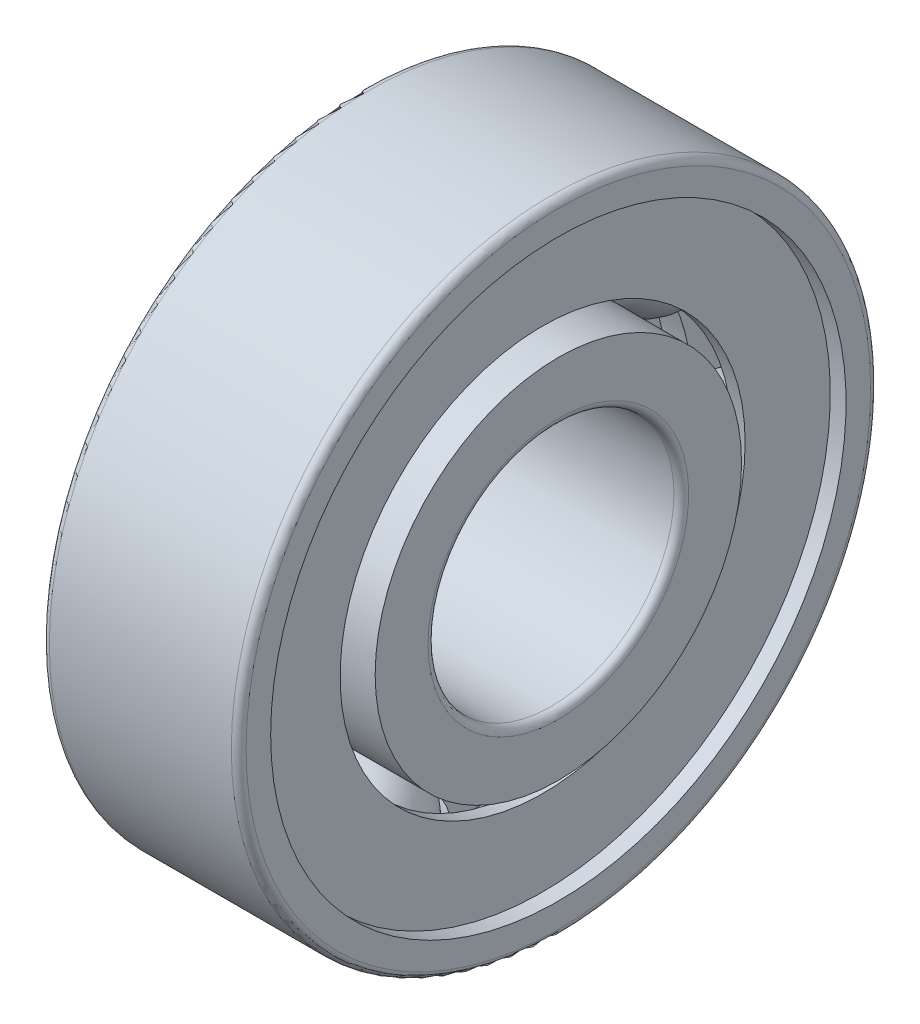
from build123d import *

# Parameters (mm, degrees)
SKETCH_2_W               = 1.04764
SKETCH_2_H               = 1.30955
PATTERN_CIRCULAR_1_COUNT = 7
SKETCH_4_W               = 5.2382
SKETCH_4_H               = 2.6191
SKETCH_5_W               = 5.2382
SKETCH_5_H               = 2.6191
PATTERN_CIRCULAR_2_COUNT = 7
SKETCH_10_W              = 0.535202
SKETCH_10_H              = 3.06427
SKETCH_11_R              = 13
CUT_EXTRUDE_1_DEPTH      = 10


with BuildPart() as part:
    # 草图2 → Revolve 388 (revolve)
    with BuildSketch(Plane.XY):
        with Locations((0, 9.575)):
            Rectangle(SKETCH_2_W, SKETCH_2_H)
    revolve(axis=Axis((-12.42061, 0, 0), (1, 0, 0)))

    # 草图3 → 凸台-旋转1 (revolve)
    with BuildSketch(Plane.XY):
        with BuildLine():
            Line((-2.6191, 9.575), (2.6191, 9.575))
            ThreePointArc((2.6191, 9.575), (0, 6.9559), (-2.6191, 9.575))
        make_face()
    revolve_1 = revolve(axis=Axis((-5.568094, 9.575, 0), (1, 0, 0)))

    # 阵列(圆周)1: 凸台-旋转1 ×7 about axis
    pattern_circular_1_axis = Axis((-12.42061, 0, 0), (1, 0, 0))
    for i in range(1, PATTERN_CIRCULAR_1_COUNT):
        add(revolve_1.rotate(pattern_circular_1_axis, i * 360 / PATTERN_CIRCULAR_1_COUNT))

    # 草图4 → 切除-旋转1 (revolve, cut)
    with BuildSketch(Plane.XY):
        with Locations((0, 11.539325)):
            Rectangle(SKETCH_4_W, SKETCH_4_H)
    revolve(axis=Axis((0, 0, 0), (1, 0, 0)), mode=Mode.SUBTRACT)

    # 草图5 → 切除-旋转2 (revolve, cut)
    with BuildSketch(Plane.XY):
        with Locations((0, 7.610675)):
            Rectangle(SKETCH_5_W, SKETCH_5_H)
    revolve(axis=Axis((0, 0, 0), (1, 0, 0)), mode=Mode.SUBTRACT)

    # 草图6 → 凸台-旋转2 (revolve)
    with BuildSketch(Plane.XY):
        with BuildLine():
            Line((-2.381, 9.575), (2.381, 9.575))
            ThreePointArc((2.381, 9.575), (0, 7.194), (-2.381, 9.575))
        make_face()
    revolve_2 = revolve(axis=Axis((-5.568094, 9.575, 0), (1, 0, 0)))

    # 阵列(圆周)2: 凸台-旋转2 ×7 about axis
    pattern_circular_2_axis = Axis((-12.42061, 0, 0), (1, 0, 0))
    for i in range(1, PATTERN_CIRCULAR_2_COUNT):
        add(revolve_2.rotate(pattern_circular_2_axis, i * 360 / PATTERN_CIRCULAR_2_COUNT))

    # 草图7 → 凸台-旋转3 (revolve)
    with BuildSketch(Plane.XY):
        with BuildLine():
            Line((-3.7, 13), (3.7, 13))
            ThreePointArc((3.7, 13), (3.912132, 12.912132), (4, 12.7))
            Line((4, 12.7), (4, 11.7))
            Line((4, 11.7), (3.36, 11.7))
            Line((3.36, 11.7), (3.36, 11.3))
            Line((3.36, 11.3), (2.824798, 11.3))
            Line((2.824798, 11.3), (2.824798, 11.7))
            Line((2.824798, 11.7), (1.051673, 11.7))
            ThreePointArc((1.051673, 11.7), (0, 11.946), (-1.051673, 11.7))
            Line((-1.051673, 11.7), (-4, 11.7))
            Line((-4, 11.7), (-4, 12.7))
            ThreePointArc((-4, 12.7), (-3.912132, 12.912132), (-3.7, 13))
        make_face()
    revolve(axis=Axis((0, 0, 0), (1, 0, 0)))

    # 草图8 → 凸台-旋转4 (revolve)
    with BuildSketch(Plane.XY):
        with BuildLine():
            Line((-4, 7.45), (-1.051673, 7.45))
            ThreePointArc((-1.051673, 7.45), (0, 7.204), (1.051673, 7.45))
            Line((1.051673, 7.45), (4, 7.45))
            Line((4, 7.45), (4, 5.3))
            ThreePointArc((4, 5.3), (3.912132, 5.087868), (3.7, 5))
            Line((3.7, 5), (-3.7, 5))
            ThreePointArc((-3.7, 5), (-3.912132, 5.087868), (-4, 5.3))
            Line((-4, 5.3), (-4, 7.45))
        make_face()
    revolve(axis=Axis((-12.42061, 0, 0), (1, 0, 0)))

    # 草图10 → 凸台-旋转5 (revolve)
    with BuildSketch(Plane.XY):
        with Locations((3.092399, 9.767865)):
            Rectangle(SKETCH_10_W, SKETCH_10_H)
    revolve(axis=Axis((0, 0, 0), (-1, 0, 0)))

    # 草图11 → 切除-拉伸1 (cut)
    with BuildSketch(Plane(origin=(0, 0, 0), x_dir=(0, 0, -1), z_dir=(1, 0, 0))):
        Circle(SKETCH_11_R)
    extrude(amount=-CUT_EXTRUDE_1_DEPTH, mode=Mode.SUBTRACT)

    # 镜向所有1: part across plane


with BuildPart() as part_1:
    add(part.part)
    add(part.part.mirror(Plane(origin=(0, 0, 0), x_dir=(0, 0, 1), z_dir=(1, 0, 0))))


solid = part_1.part
